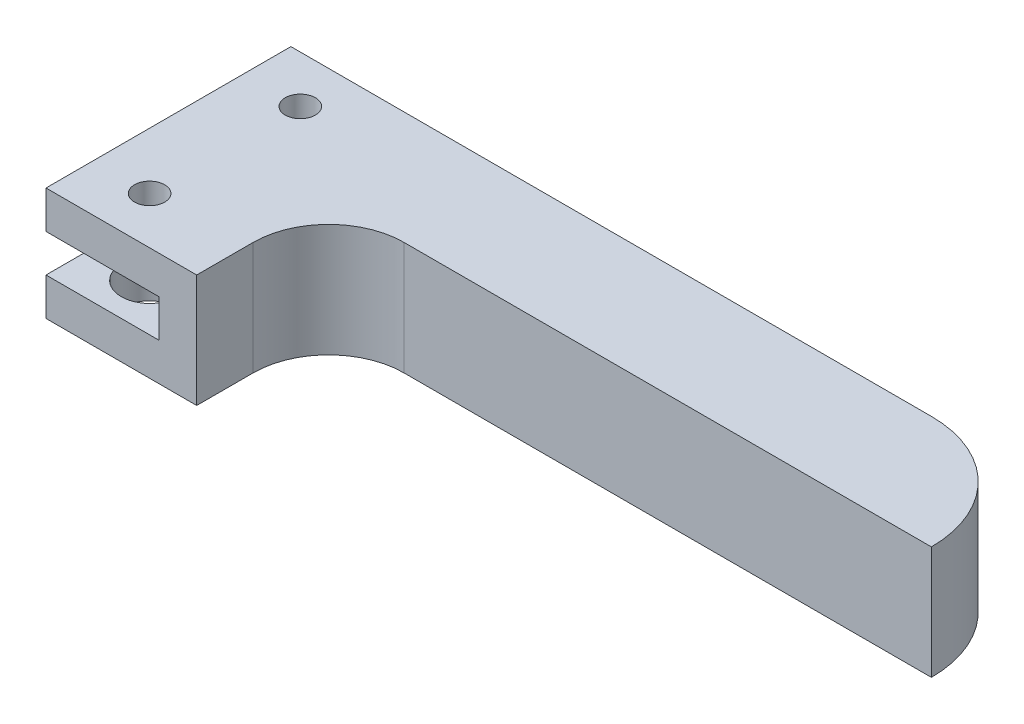
from build123d import *

# Parameters (mm, degrees)
SKETCH1_W           = 40
SKETCH1_H           = 13
BOSS_EXTRUDE1_DEPTH = 6
SKETCH2_W           = 6
SKETCH2_H           = 2
CUT_EXTRUDE1_DEPTH  = 25.596747752
SKETCH3_R           = 0.8
CUT_EXTRUDE2_DEPTH  = 2
SKETCH4_W           = 32
SKETCH4_H           = 7
CUT_EXTRUDE3_DEPTH  = 22.868927729
FILLET1_R           = 4
FILLET3_R           = 6
SKETCH5_R           = 1.5
CUT_EXTRUDE4_DEPTH  = 2


with BuildPart() as part:
    # Sketch1 → Boss-Extrude1 (new body)
    with BuildSketch(Plane(origin=(0, 0, 0), x_dir=(1, 0, 0), z_dir=(0, 1, 0))):
        Rectangle(SKETCH1_W, SKETCH1_H)
    extrude(amount=BOSS_EXTRUDE1_DEPTH)

    # Sketch2 → Cut-Extrude1 (cut, through all)
    with BuildSketch(Plane.XY.offset(6.5)):
        with Locations((-17, 3)):
            Rectangle(SKETCH2_W, SKETCH2_H)
    extrude(amount=-CUT_EXTRUDE1_DEPTH, mode=Mode.SUBTRACT)

    # Sketch3 → Cut-Extrude2 (cut)
    with BuildSketch(Plane(origin=(0, 6, 0), x_dir=(1, 0, 0), z_dir=(0, 1, 0))):
        with Locations(Location((-17, 4, 0), (0, 0, 270))):
            Circle(SKETCH3_R)
        with Locations(Location((-17, -4, 0), (0, 0, 270))):
            Circle(SKETCH3_R)
    extrude(amount=-CUT_EXTRUDE2_DEPTH, mode=Mode.SUBTRACT)

    # Sketch4 → Cut-Extrude3 (cut, through all)
    with BuildSketch(Plane(origin=(0, 6, 0), x_dir=(1, 0, 0), z_dir=(0, 1, 0))):
        with Locations((4, -3)):
            Rectangle(SKETCH4_W, SKETCH4_H)
    extrude(amount=-CUT_EXTRUDE3_DEPTH, mode=Mode.SUBTRACT)

    # Fillet1
    fillet1_edges = [part.edges().sort_by_distance(p)[0] for p in [
        (-12, 3, -0.5),
    ]]
    fillet(fillet1_edges, radius=FILLET1_R)

    # Fillet3
    fillet3_edges = [part.edges().sort_by_distance(p)[0] for p in [
        (20, 3, -6.5),
    ]]
    fillet(fillet3_edges, radius=FILLET3_R - 0.0001)  # a hair under: the kernel refuses the full size

    # Sketch5 → Cut-Extrude4 (cut)
    with BuildSketch(Plane(origin=(0, 2, 0), x_dir=(1, 0, 0), z_dir=(0, 1, 0))):
        with Locations(Location((-17, 4, 0), (0, 0, 270))):
            Circle(SKETCH5_R)
        with Locations(Location((-17, -4, 0), (0, 0, 270))):
            Circle(SKETCH5_R)
    extrude(amount=-CUT_EXTRUDE4_DEPTH, mode=Mode.SUBTRACT)


solid = part.part
